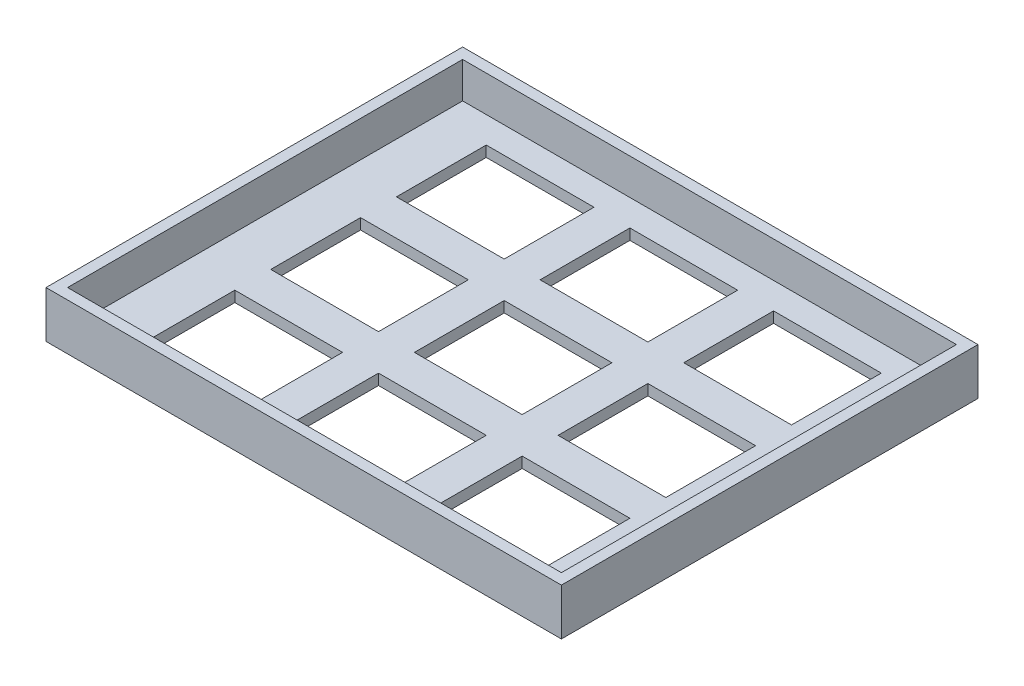
from build123d import *

# Parameters (mm, degrees)
SKETCH1_W           = 55
SKETCH1_H           = 44
BOSS_EXTRUDE1_DEPTH = 4
SHELL1_T            = 1.2
SKETCH2_W           = 12
SKETCH2_H           = 10
CUT_EXTRUDE2_DEPTH  = 73.232125817


with BuildPart() as part:
    # Sketch1 → Boss-Extrude1 (new body)
    with BuildSketch(Plane(origin=(0, 0, 0), x_dir=(1, 0, 0), z_dir=(0, 1, 0))):
        with Locations((27.5, -22)):
            Rectangle(SKETCH1_W, SKETCH1_H)
    extrude(amount=BOSS_EXTRUDE1_DEPTH)

    # Shell1
    shell1_openings = [part.faces().sort_by_distance(p)[0] for p in [
        (27.5, 4, 22),
    ]]
    offset(amount=SHELL1_T, openings=shell1_openings, kind=Kind.INTERSECTION)

    # Sketch2 → Cut-Extrude2 (cut, through all)
    with BuildSketch(Plane(origin=(0, 0, 0), x_dir=(1, 0, 0), z_dir=(0, 1, 0))):
        with Locations((27.570068873, -35.939193744)):
            Rectangle(SKETCH2_W, SKETCH2_H)
        with Locations((43.570068873, -35.939193744)):
            Rectangle(SKETCH2_W, SKETCH2_H)
        with Locations((11.570068873, -35.939193744)):
            Rectangle(SKETCH2_W, SKETCH2_H)
        with Locations((27.570068873, -21.939193744)):
            Rectangle(SKETCH2_W, SKETCH2_H)
        with Locations((11.570068873, -21.939193744)):
            Rectangle(SKETCH2_W, SKETCH2_H)
        with Locations((27.570068873, -7.939193744)):
            Rectangle(SKETCH2_W, SKETCH2_H)
        with Locations((11.570068873, -7.939193744)):
            Rectangle(SKETCH2_W, SKETCH2_H)
        with Locations((43.570068873, -21.939193744)):
            Rectangle(SKETCH2_W, SKETCH2_H)
        with Locations((43.570068873, -7.939193744)):
            Rectangle(SKETCH2_W, SKETCH2_H)
    extrude(amount=-CUT_EXTRUDE2_DEPTH, mode=Mode.SUBTRACT)


solid = part.part
